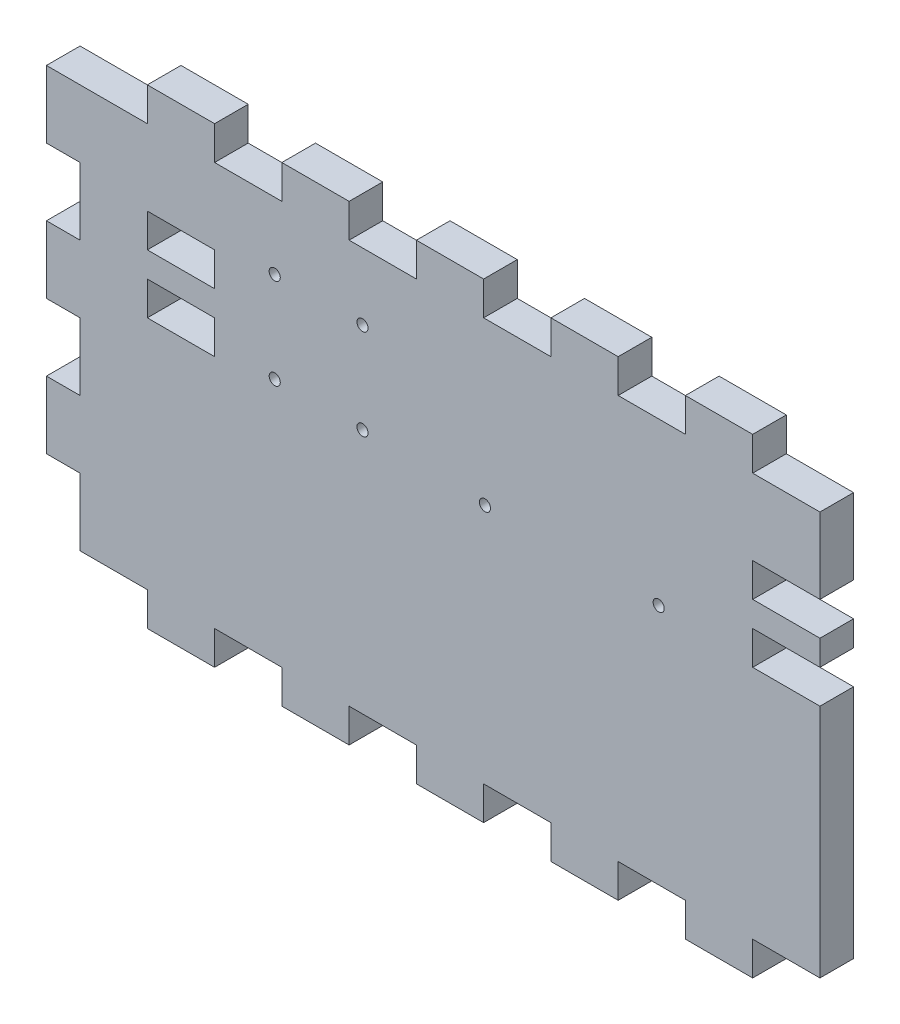
from build123d import *

# Parameters (mm, degrees)
SKETCH1_W               = 279.4
SKETCH1_H               = 152.4
BOSS_EXTRUDE1_DEPTH     = 12.7
SKETCH2_W               = 25.4
SKETCH2_H               = 12.7
BOSS_EXTRUDE2_DEPTH     = 12.7
LPATTERN1_COUNT         = 5
LPATTERN1_PITCH         = 50.8
MIRROR1_COPY_1_SKETCH_W = 25.4
MIRROR1_COPY_1_SKETCH_H = 12.7
MIRROR1_COPY_1_DEPTH    = 12.7
MIRROR1_COPY_2_SKETCH_W = 25.4
MIRROR1_COPY_2_SKETCH_H = 12.7
MIRROR1_COPY_2_DEPTH    = 12.7
MIRROR1_COPY_3_SKETCH_W = 25.4
MIRROR1_COPY_3_SKETCH_H = 12.7
MIRROR1_COPY_3_DEPTH    = 12.7
MIRROR1_COPY_4_SKETCH_W = 25.4
MIRROR1_COPY_4_SKETCH_H = 12.7
MIRROR1_COPY_4_DEPTH    = 12.7
MIRROR1_COPY_5_SKETCH_W = 25.4
MIRROR1_COPY_5_SKETCH_H = 12.7
MIRROR1_COPY_5_DEPTH    = 12.7
SKETCH3_W               = 12.7
SKETCH3_H               = 25.4
BOSS_EXTRUDE3_DEPTH     = 12.7
LPATTERN2_COUNT         = 3
LPATTERN2_PITCH         = 50.8
SKETCH4_W               = 25.4
SKETCH4_H               = 12.7
CUT_EXTRUDE1_DEPTH      = 177.89053112
LPATTERN3_COUNT         = 2
LPATTERN3_PITCH         = 228.6
SKETCH5_W               = 25.4
SKETCH5_H               = 12.7
CUT_EXTRUDE2_DEPTH      = 177.89053112
LPATTERN4_COUNT         = 2
LPATTERN4_PITCH         = 228.6
SKETCH6_R               = 2.1
CUT_EXTRUDE3_DEPTH      = 177.89053112


with BuildPart() as part:
    # Sketch1 → Boss-Extrude1 (new body)
    with BuildSketch(Plane.XY):
        Rectangle(SKETCH1_W, SKETCH1_H)
    extrude(amount=BOSS_EXTRUDE1_DEPTH)

    # Sketch2 → Boss-Extrude2 (add)
    with BuildSketch(Plane.XZ.offset(76.2)):
        with Locations((-101.6, 6.35)):
            Rectangle(SKETCH2_W, SKETCH2_H)
    boss_extrude2 = extrude(amount=BOSS_EXTRUDE2_DEPTH)

    # LPattern1: Boss-Extrude2 ×5
    with Locations(*[(i * LPATTERN1_PITCH, 0, 0) for i in range(1, LPATTERN1_COUNT)]):
        add(boss_extrude2)

    # Mirror1 copy 1 sketch → Mirror1 copy 1 (add)
    with BuildSketch(Plane(origin=(50.8, 76.2, 0), x_dir=(1, 0, 0), z_dir=(0, 1, 0))):
        with Locations((-101.6, -6.35)):
            Rectangle(MIRROR1_COPY_1_SKETCH_W, MIRROR1_COPY_1_SKETCH_H)
    extrude(amount=MIRROR1_COPY_1_DEPTH)

    # Mirror1 copy 2 sketch → Mirror1 copy 2 (add)
    with BuildSketch(Plane(origin=(101.6, 76.2, 0), x_dir=(1, 0, 0), z_dir=(0, 1, 0))):
        with Locations((-101.6, -6.35)):
            Rectangle(MIRROR1_COPY_2_SKETCH_W, MIRROR1_COPY_2_SKETCH_H)
    extrude(amount=MIRROR1_COPY_2_DEPTH)

    # Mirror1 copy 3 sketch → Mirror1 copy 3 (add)
    with BuildSketch(Plane(origin=(152.4, 76.2, 0), x_dir=(1, 0, 0), z_dir=(0, 1, 0))):
        with Locations((-101.6, -6.35)):
            Rectangle(MIRROR1_COPY_3_SKETCH_W, MIRROR1_COPY_3_SKETCH_H)
    extrude(amount=MIRROR1_COPY_3_DEPTH)

    # Mirror1 copy 4 sketch → Mirror1 copy 4 (add)
    with BuildSketch(Plane(origin=(203.2, 76.2, 0), x_dir=(1, 0, 0), z_dir=(0, 1, 0))):
        with Locations((-101.6, -6.35)):
            Rectangle(MIRROR1_COPY_4_SKETCH_W, MIRROR1_COPY_4_SKETCH_H)
    extrude(amount=MIRROR1_COPY_4_DEPTH)

    # Mirror1 copy 5 sketch → Mirror1 copy 5 (add)
    with BuildSketch(Plane(origin=(0, 76.2, 0), x_dir=(1, 0, 0), z_dir=(0, 1, 0))):
        with Locations((-101.6, -6.35)):
            Rectangle(MIRROR1_COPY_5_SKETCH_W, MIRROR1_COPY_5_SKETCH_H)
    extrude(amount=MIRROR1_COPY_5_DEPTH)

    # Sketch3 → Boss-Extrude3 (add)
    with BuildSketch(Plane.ZY.offset(139.7)):
        with Locations((6.35, 63.5)):
            Rectangle(SKETCH3_W, SKETCH3_H)
    boss_extrude3 = extrude(amount=BOSS_EXTRUDE3_DEPTH)

    # LPattern2: Boss-Extrude3 ×3
    with Locations(*[(0, -i * LPATTERN2_PITCH, 0) for i in range(1, LPATTERN2_COUNT)]):
        add(boss_extrude3)

    # Sketch4 → Cut-Extrude1 (cut, through all)
    with BuildSketch(Plane(origin=(0, 0, 0), x_dir=(-1, 0, 0), z_dir=(0, 0, -1))):
        with Locations((-127, 19.05)):
            Rectangle(SKETCH4_W, SKETCH4_H)
    cut_extrude1 = extrude(amount=-CUT_EXTRUDE1_DEPTH, mode=Mode.SUBTRACT)

    # LPattern3: Cut-Extrude1 ×2
    with Locations(*[(-i * LPATTERN3_PITCH, 0, 0) for i in range(1, LPATTERN3_COUNT)]):
        add(cut_extrude1, mode=Mode.SUBTRACT)

    # Sketch5 → Cut-Extrude2 (cut, through all)
    with BuildSketch(Plane.XY.offset(12.7)):
        with Locations((-101.6, 41.275)):
            Rectangle(SKETCH5_W, SKETCH5_H)
    cut_extrude2 = extrude(amount=-CUT_EXTRUDE2_DEPTH, mode=Mode.SUBTRACT)

    # LPattern4: Cut-Extrude2 ×2
    with Locations(*[(i * LPATTERN4_PITCH, 0, 0) for i in range(1, LPATTERN4_COUNT)]):
        add(cut_extrude2, mode=Mode.SUBTRACT)

    # Sketch6 → Cut-Extrude3 (cut, through all)
    with BuildSketch(Plane(origin=(0, 0, 0), x_dir=(-1, 0, 0), z_dir=(0, 0, -1))):
        with Locations((-78.811081859, 15.175)):
            Circle(SKETCH6_R)
        with Locations((-13.203881859, 15.175)):
            Circle(SKETCH6_R)
        with Locations((66.195004141, 16.68377)):
            Circle(SKETCH6_R)
        with Locations((33.045004141, 50.945)):
            Circle(SKETCH6_R)
        with Locations((66.195004141, 50.945)):
            Circle(SKETCH6_R)
        with Locations((33.045004141, 16.68377)):
            Circle(SKETCH6_R)
    extrude(amount=-CUT_EXTRUDE3_DEPTH, mode=Mode.SUBTRACT)


solid = part.part
